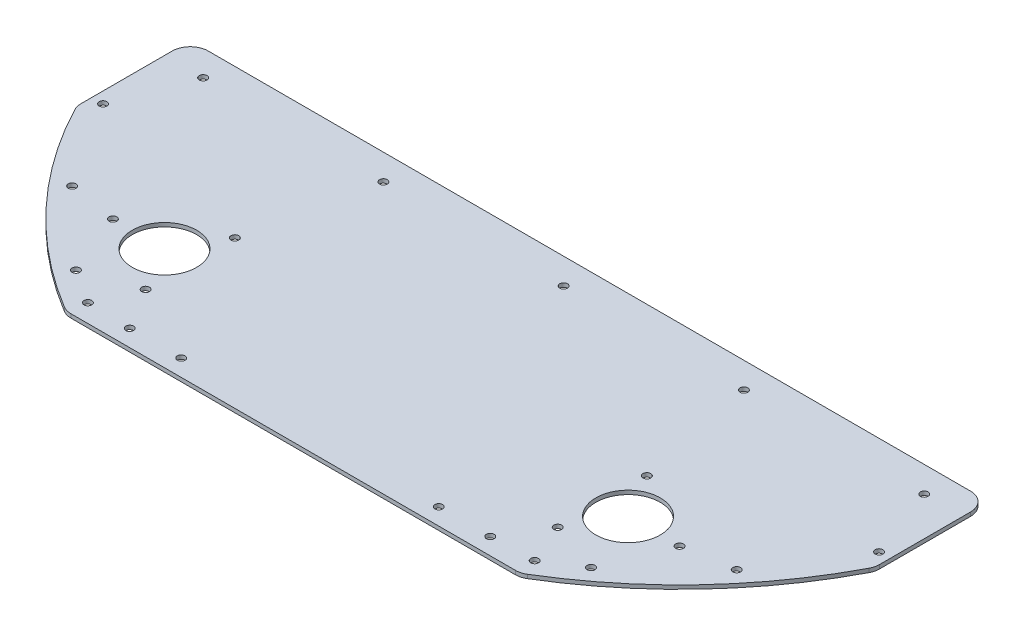
from build123d import *

# Parameters (mm, degrees)
ESQUISSE1_R                   = 1.5
ESQUISSE1_R_2                 = 12.5
BOSS_EXTRU_1_DEPTH            = 1.5
CONG_1_R                      = 7
DIAM_TRE_DU_PER_AGE_3_0_3_1_D = 3


with BuildPart() as part:
    # Esquisse1 → Boss.-Extru.1 (new body)
    with BuildSketch(Plane(origin=(0, 0, 0), x_dir=(1, 0, 0), z_dir=(0, 1, 0))):
        with BuildLine():
            Line((-155, -35), (155, -35))
            Line((155, -35), (155, -79.063265807))
            ThreePointArc((155, -79.063265807), (126.658325612, -119.304939349), (88.18163074, -150))
            Line((88.18163074, -150), (-88.18163074, -150))
            ThreePointArc((-88.18163074, -150), (-126.658325612, -119.304939349), (-155, -79.063265807))
            Line((-155, -79.063265807), (-155, -35))
        make_face()
        with Locations((-70, -45)):
            Circle(ESQUISSE1_R, mode=Mode.SUBTRACT)
        with Locations((0, -45)):
            Circle(ESQUISSE1_R, mode=Mode.SUBTRACT)
        with Locations((90, -110)):
            Circle(ESQUISSE1_R_2, mode=Mode.SUBTRACT)
        with Locations((80, -127.320508076)):
            Circle(ESQUISSE1_R, mode=Mode.SUBTRACT)
        with Locations((110, -110)):
            Circle(ESQUISSE1_R, mode=Mode.SUBTRACT)
        with Locations((80, -92.679491924)):
            Circle(ESQUISSE1_R, mode=Mode.SUBTRACT)
        with Locations((70, -45)):
            Circle(ESQUISSE1_R, mode=Mode.SUBTRACT)
        with Locations((-140, -45)):
            Circle(ESQUISSE1_R, mode=Mode.SUBTRACT)
        with Locations((140, -45)):
            Circle(ESQUISSE1_R, mode=Mode.SUBTRACT)
        with Locations((-86.738471856, -143)):
            Circle(ESQUISSE1_R, mode=Mode.SUBTRACT)
        with Locations((86.738471856, -143)):
            Circle(ESQUISSE1_R, mode=Mode.SUBTRACT)
        with Locations((-80, -92.679491924)):
            Circle(ESQUISSE1_R, mode=Mode.SUBTRACT)
        with Locations((-80, -127.320508076)):
            Circle(ESQUISSE1_R, mode=Mode.SUBTRACT)
        with Locations((-90, -110)):
            Circle(ESQUISSE1_R_2, mode=Mode.SUBTRACT)
        with Locations((-110, -110)):
            Circle(ESQUISSE1_R, mode=Mode.SUBTRACT)
    extrude(amount=BOSS_EXTRU_1_DEPTH)

    # Congé1
    cong_1_edges = [part.edges().sort_by_distance(p)[0] for p in [
        (-155, 0.75, 35),
        (155, 0.75, 35),
        (155, 0.75, 79.063265807),
        (88.18163074, 0.75, 150),
        (-155, 0.75, 79.063265807),
        (-88.18163074, 0.75, 150),
    ]]
    fillet(cong_1_edges, radius=CONG_1_R)

    # Diamètre du perçage Ø3.0 (3)1 (through all)
    with Locations(Plane(origin=(0, 1.5, 0), x_dir=(1, 0, 0), z_dir=(0, 1, 0))):
        with Locations((-150.659322244, -73.198487832), (-129.008220311, -106.832247435), (-100, -134.373546504), (-70, -143.5), (-50, -143.5), (70, -143.5), (100, -134.373546504), (129.008220311, -106.832247435), (150.659322244, -73.198487832), (50, -143.5)):
            Hole(DIAM_TRE_DU_PER_AGE_3_0_3_1_D / 2)


solid = part.part
